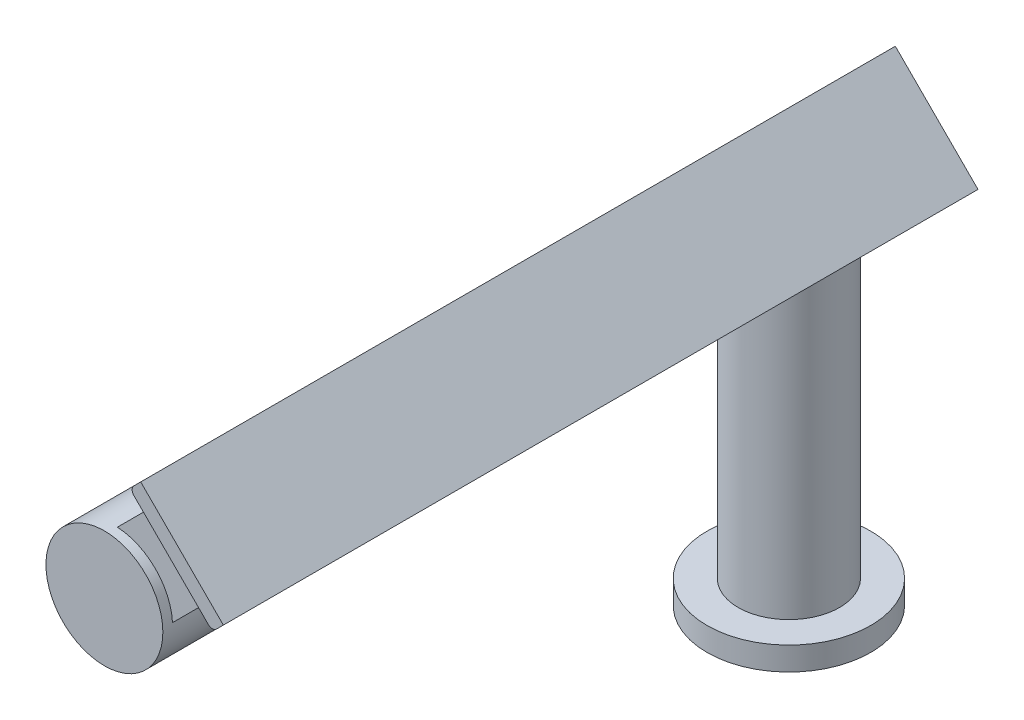
from build123d import *

# Parameters (mm, degrees)
HEAD_START          = -373.18
HEAD_FLANGE_DEPTH   = 387.28
PRIMARY_START       = -28.9
PRIMARY_2_DEPTH     = 34
PRIMARY_START_2     = -140.66
PRIMARY_4_DEPTH     = 34
PRIMARY_START_3     = -252.42
PRIMARY_6_DEPTH     = 34
PRIMARY_START_4     = -364.18
PRIMARY_8_DEPTH     = 34
COLLECTOR_START     = -367.18
SKETCH6_R           = 30
COLLECTOR_DEPTH     = 377.28
OUTLET_START        = -60
SKETCH7_R           = 26
OUTLET_PIPE_DEPTH   = 166.73776862
OUTLET_START_2      = -72
SKETCH8_R           = 42
OUTLET_FLANGE_DEPTH = 12
OUTLET_START_3      = -73
SKETCH9_R           = 20
OUTLET_BORE_DEPTH   = 169.73776862


with BuildPart() as part:
    # Sketch1 → Head Flange (new body)
    with BuildSketch(Plane.XY.offset(HEAD_START)):
        with BuildLine():
            Line((-231.188562109, 129.365185618), (-234.724096015, 125.829651712))
            ThreePointArc((-234.724096015, 125.829651712), (-236.845416358, 124.950972056), (-238.966736702, 125.829651712))
            Line((-238.966736702, 125.829651712), (-277.150502886, 164.013417896))
            ThreePointArc((-277.150502886, 164.013417896), (-278.029182543, 166.13473824), (-277.150502886, 168.256058583))
            Line((-277.150502886, 168.256058583), (-273.61496898, 171.791592489))
            Line((-273.61496898, 171.791592489), (-231.188562109, 129.365185618))
        make_face()
    extrude(amount=HEAD_FLANGE_DEPTH)

    # Sketch2 → Primary 2 (add)
    with BuildSketch(Plane.XY.offset(PRIMARY_START)):
        Polygon((-238.259629921, 136.43625343), (-282.100250354, 92.595632996), (-310.384521602, 120.879904244), (-266.543901168, 164.720524677), align=None)
    extrude(amount=PRIMARY_2_DEPTH)

    # Sketch3 → Primary 4 (add)
    with BuildSketch(Plane.XY.offset(PRIMARY_START_2)):
        Polygon((-238.259629921, 136.43625343), (-282.100250354, 92.595632996), (-310.384521602, 120.879904244), (-266.543901168, 164.720524677), align=None)
    extrude(amount=PRIMARY_4_DEPTH)

    # Sketch4 → Primary 6 (add)
    with BuildSketch(Plane.XY.offset(PRIMARY_START_3)):
        Polygon((-238.259629921, 136.43625343), (-282.100250354, 92.595632996), (-310.384521602, 120.879904244), (-266.543901168, 164.720524677), align=None)
    extrude(amount=PRIMARY_6_DEPTH)

    # Sketch5 → Primary 8 (add)
    with BuildSketch(Plane.XY.offset(PRIMARY_START_4)):
        Polygon((-238.259629921, 136.43625343), (-282.100250354, 92.595632996), (-310.384521602, 120.879904244), (-266.543901168, 164.720524677), align=None)
    extrude(amount=PRIMARY_8_DEPTH)

    # Sketch6 → Collector (add)
    with BuildSketch(Plane.XY.offset(COLLECTOR_START)):
        with Locations((-296.242385978, 106.73776862)):
            Circle(SKETCH6_R)
    extrude(amount=COLLECTOR_DEPTH)

    # Sketch7 → Outlet Pipe (add)
    with BuildSketch(Plane(origin=(0, 0, 0), x_dir=(1, 0, 0), z_dir=(0, 1, 0)).offset(OUTLET_START)):
        with Locations((-296.242385978, 341.18)):
            Circle(SKETCH7_R)
    extrude(amount=OUTLET_PIPE_DEPTH)

    # Sketch8 → Outlet Flange (add)
    with BuildSketch(Plane(origin=(0, 0, 0), x_dir=(1, 0, 0), z_dir=(0, 1, 0)).offset(OUTLET_START_2)):
        with Locations((-296.242385978, 341.18)):
            Circle(SKETCH8_R)
    extrude(amount=OUTLET_FLANGE_DEPTH)

    # Sketch9 → Outlet Bore (cut)
    with BuildSketch(Plane(origin=(0, 0, 0), x_dir=(1, 0, 0), z_dir=(0, 1, 0)).offset(OUTLET_START_3)):
        with Locations((-296.242385978, 341.18)):
            Circle(SKETCH9_R)
    extrude(amount=OUTLET_BORE_DEPTH, mode=Mode.SUBTRACT)


solid = part.part
